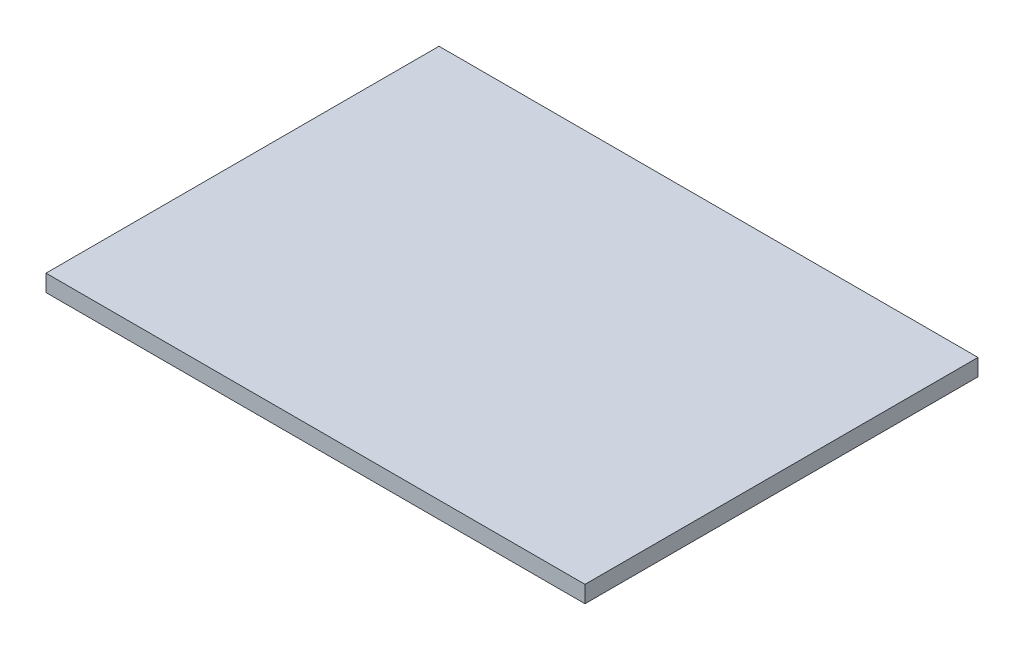
from build123d import *

# Parameters (mm, degrees)
SKETCH1_W           = 243.84
SKETCH1_H           = 177.8
SKETCH1_W_2         = 233.68
SKETCH1_H_2         = 167.64
BOSS_EXTRUDE7_DEPTH = 7.62
SKETCH6_W           = 233.68
SKETCH6_H           = 167.64
BOSS_EXTRUDE8_DEPTH = 7.62


with BuildPart() as part:
    # Sketch1 → Boss-Extrude7 (new body)
    with BuildSketch(Plane(origin=(0, 0, 0), x_dir=(1, 0, 0), z_dir=(0, 1, 0))):
        with Locations((121.92, 88.9)):
            Rectangle(SKETCH1_W, SKETCH1_H)
        with Locations((121.92, 88.9)):
            Rectangle(SKETCH1_W_2, SKETCH1_H_2, mode=Mode.SUBTRACT)
    extrude(amount=BOSS_EXTRUDE7_DEPTH)

    # Sketch6 → Boss-Extrude8 (add)
    with BuildSketch(Plane(origin=(0, 7.62, 0), x_dir=(1, 0, 0), z_dir=(0, 1, 0))):
        with Locations((121.92, 88.9)):
            Rectangle(SKETCH6_W, SKETCH6_H)
    extrude(amount=-BOSS_EXTRUDE8_DEPTH)


solid = part.part
